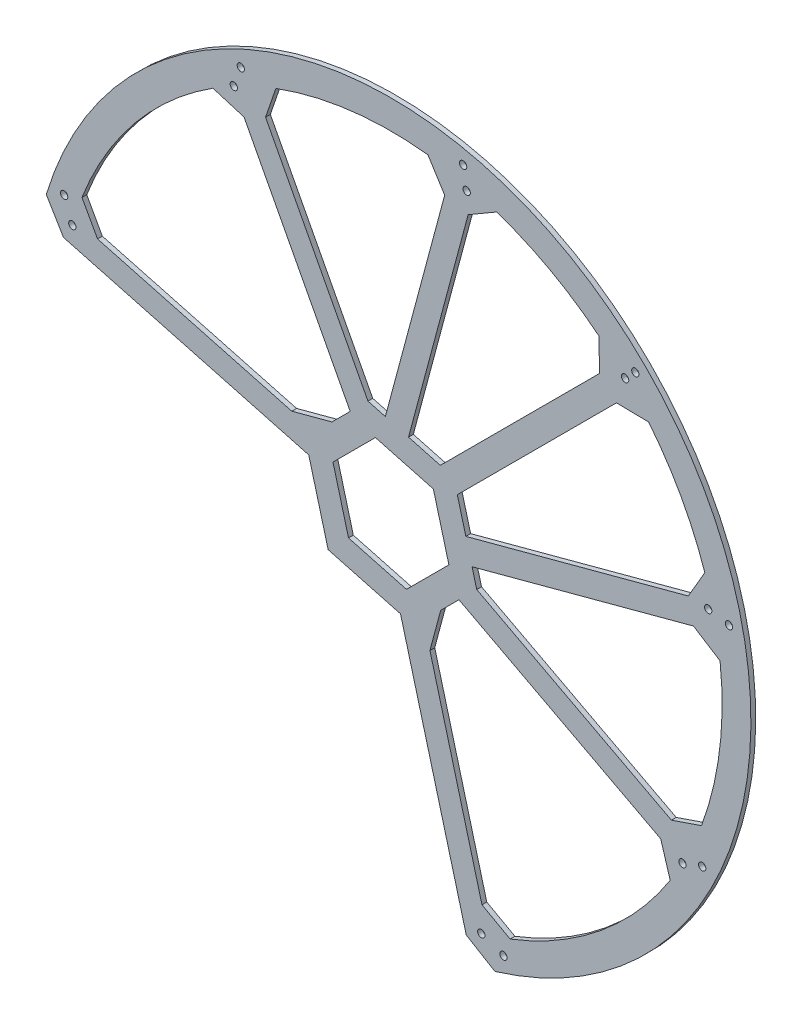
from build123d import *

# Parameters (mm, degrees)
EXTRUDE_11_DEPTH    = 2
CHAMFER_1_SIZE      = 10
CHAMFER_3_SIZE      = 10
SKETCH_4_R          = 1.52
CUT_EXTRUDE_1_DEPTH = 10


with BuildPart() as part:
    # 草图2 → 凸台-拉伸11 (new body)
    with BuildSketch(Plane.XY):
        with BuildLine():
            Line((116.986968716, -171.866279839), (116.986166566, -171.866494817))
            Line((116.986166566, -171.866494817), (146.957834859, -283.724244016))
            ThreePointArc((146.95783486, -283.724244021), (219.052953151, -31.555197901), (-33.116092969, -103.650316192))
            Line((-33.116092963, -103.650316193), (78.741656236, -133.621984487))
            Line((78.741656247, -133.621984484), (86.823548141, -163.784015655))
            Line((86.823548141, -163.784015655), (86.824011296, -163.784139757))
            Line((86.824011296, -163.784139757), (116.986968716, -171.866279839))
        make_face()
        Polygon((119.456975173, -161.769210408), (95.30929267, -155.298858383), (95.308829516, -155.298734281), (88.838353388, -131.150588624), (106.516022918, -113.472919094), (130.664168575, -119.943395221), (137.134644703, -144.091540879), align=None, mode=Mode.SUBTRACT)
        with BuildLine():
            Line((126.645296946, -169.277827092), (141.323054558, -154.60006948))
            Line((141.323054558, -154.60006948), (234.255998853, -203.48188474))
            ThreePointArc((234.255998853, -203.48188474), (200.365014055, -244.433677808), (153.509224986, -269.537128502))
            Line((153.509224986, -269.537128502), (126.645296946, -169.277827092))
        make_face(mode=Mode.SUBTRACT)
        with BuildLine():
            ThreePointArc((248.706632523, -112.641381763), (249.968706378, -154.348708565), (238.707168991, -194.526708951))
            Line((238.707168991, -194.526708951), (148.725754618, -147.19736942))
            Line((148.725754618, -147.19736942), (146.784206577, -139.951413486))
            Line((146.784206577, -139.951413486), (248.706632523, -112.641381763))
        make_face(mode=Mode.SUBTRACT)
        with BuildLine():
            ThreePointArc((-18.929686723, -97.098736021), (6.17383244, -50.2426152), (47.125895572, -16.351447355))
            Line((47.125895572, -16.351447355), (96.007676733, -109.284326822))
            Line((96.007676733, -109.284326822), (81.329397649, -123.962605906))
            Line((81.329397649, -123.962605906), (-18.929686723, -97.098736021))
        make_face(mode=Mode.SUBTRACT)
        with BuildLine():
            ThreePointArc((56.081079681, -11.900293037), (96.259335826, -0.638798731), (137.966891648, -1.901061882))
            Line((137.966891648, -1.901061882), (110.656845042, -103.823543372))
            Line((110.656845042, -103.823543372), (103.410518411, -101.881896003))
            Line((103.410518411, -101.881896003), (56.081079681, -11.900293037))
        make_face(mode=Mode.SUBTRACT)
        with BuildLine():
            ThreePointArc((147.738817906, -4.068769649), (179.372913634, -16.638491001), (206.967778767, -36.569304474))
            Line((206.967778767, -36.569304474), (133.573137745, -109.963945495))
            Line((133.573137745, -109.963945495), (120.316103305, -106.411733823))
            Line((120.316103305, -106.411733823), (147.738817906, -4.068769649))
        make_face(mode=Mode.SUBTRACT)
        with BuildLine():
            ThreePointArc((214.038825287, -43.640393577), (233.969445691, -71.235329731), (246.538975276, -102.869441968))
            Line((246.538975276, -102.869441968), (144.196016126, -130.292155223))
            Line((144.196016126, -130.292155223), (140.643866505, -117.03535236))
            Line((140.643866505, -117.03535236), (214.038825287, -43.640393577))
        make_face(mode=Mode.SUBTRACT)
    extrude(amount=-EXTRUDE_11_DEPTH)

    # 倒角1
    # the kernel refuses this chamfer: 10 mm, written as the material it adds along each edge
    with BuildSketch(Plane(origin=(246.538975276, -102.869441968, 0), x_dir=(-0.28555901452107074, 0.9583611267292487, 0), z_dir=(0, 0, -1))) as chamfer_1_piece_1:
        with BuildLine():
            Line((9.665018265, 0), (CHAMFER_1_SIZE * 0.0277867153721, -CHAMFER_1_SIZE * 0.999613874678))
            Line((CHAMFER_1_SIZE * 0.0277867153721, -CHAMFER_1_SIZE * 0.999613874678), (0, 0))
            ThreePointArc((0, 0), (4.969359021, 0.084571078), (9.665018265, 0))
        make_face()
    extrude(amount=2)
    with BuildSketch(Plane(origin=(214.038825287, -43.640393577, 0), x_dir=(-0.707106781186561, -0.707106781186534, 0), z_dir=(0, 0, -1))) as chamfer_1_piece_2:
        with BuildLine():
            Line((CHAMFER_1_SIZE, 0), (0.689672032, -9.65402706))
            ThreePointArc((0.689672032, -9.65402706), (0.269761539, -4.966357207), (0, 0))
            Line((0, 0), (CHAMFER_1_SIZE, 0))
        make_face()
    extrude(amount=2)
    with BuildSketch(Plane(origin=(238.707168991, -194.526708951, 0), x_dir=(0.38013608783902403, 0.9249305675143631, 0), z_dir=(0, 0, -1))) as chamfer_1_piece_3:
        with BuildLine():
            Line((9.685612303, 0), (CHAMFER_1_SIZE * 0.0941398773056, -CHAMFER_1_SIZE * 0.995558980423))
            Line((CHAMFER_1_SIZE * 0.0941398773056, -CHAMFER_1_SIZE * 0.995558980423), (0, 0))
            ThreePointArc((0, 0), (4.974727114, 0.084937068), (9.685612303, 0))
        make_face()
    extrude(amount=2)
    with BuildSketch(Plane(origin=(248.706632523, -112.641381763, 0), x_dir=(0.14636574749919642, -0.9892305433815727, 0), z_dir=(0, 0, -1))) as chamfer_1_piece_4:
        with BuildLine():
            Line((9.691773178, 0), (CHAMFER_1_SIZE * 0.114653249031, CHAMFER_1_SIZE * 0.99340557301))
            Line((CHAMFER_1_SIZE * 0.114653249031, CHAMFER_1_SIZE * 0.99340557301), (0, 0))
            ThreePointArc((0, 0), (4.976248684, -0.085046752), (9.691773178, 0))
        make_face()
    extrude(amount=2)
    with BuildSketch(Plane(origin=(206.967778767, -36.569304474, 0), x_dir=(-0.7556917941479319, 0.6549274099146253, 0), z_dir=(0, 0, -1))) as chamfer_1_piece_5:
        with BuildLine():
            Line((9.678628526, 0), (CHAMFER_1_SIZE * 0.0712511793936, -CHAMFER_1_SIZE * 0.997458404865))
            Line((CHAMFER_1_SIZE * 0.0712511793936, -CHAMFER_1_SIZE * 0.997458404865), (0, 0))
            ThreePointArc((0, 0), (4.972954578, 0.084812842), (9.678628526, 0))
        make_face()
    extrude(amount=2)
    with BuildSketch(Plane(origin=(147.738817906, -4.068769649, 0), x_dir=(0.9583596366559947, -0.28556401529007475, 0), z_dir=(0, 0, -1))) as chamfer_1_piece_6:
        with BuildLine():
            Line((9.665019928, 0), (CHAMFER_1_SIZE * 0.0277919314036, CHAMFER_1_SIZE * 0.999613729672))
            Line((CHAMFER_1_SIZE * 0.0277919314036, CHAMFER_1_SIZE * 0.999613729672), (0, 0))
            ThreePointArc((0, 0), (4.969359471, -0.084571108), (9.665019928, 0))
        make_face()
    extrude(amount=2)
    with BuildSketch(Plane(origin=(153.509224986, -269.537128502, 0), x_dir=(0.9450297338640432, 0.32698440652859245, 0), z_dir=(0, 0, -1))) as chamfer_1_piece_7:
        with BuildLine():
            Line((9.678629813, 0), (CHAMFER_1_SIZE * 0.071255359942, -CHAMFER_1_SIZE * 0.997458106228))
            Line((CHAMFER_1_SIZE * 0.071255359942, -CHAMFER_1_SIZE * 0.997458106228), (0, 0))
            ThreePointArc((0, 0), (4.972954909, 0.084812865), (9.678629813, 0))
        make_face()
    extrude(amount=2)
    with BuildSketch(Plane(origin=(234.255998853, -203.48188474, 0), x_dir=(-0.5077534832780394, -0.861502408713416, 0), z_dir=(0, 0, -1))) as chamfer_1_piece_8:
        with BuildLine():
            Line((9.671511766, 0), (CHAMFER_1_SIZE * 0.0483333592427, CHAMFER_1_SIZE * 0.998831260216))
            Line((CHAMFER_1_SIZE * 0.0483333592427, CHAMFER_1_SIZE * 0.998831260216), (0, 0))
            ThreePointArc((0, 0), (4.97109735, -0.08468637), (9.671511766, 0))
        make_face()
    extrude(amount=2)
    with BuildSketch(Plane(origin=(-18.929686723, -97.098736021, 0), x_dir=(0.32698155779507593, 0.9450307195334474, 0), z_dir=(0, 0, -1))) as chamfer_1_piece_9:
        with BuildLine():
            Line((9.678628888, 0), (CHAMFER_1_SIZE * 0.0712523531674, CHAMFER_1_SIZE * 0.997458321018))
            Line((CHAMFER_1_SIZE * 0.0712523531674, CHAMFER_1_SIZE * 0.997458321018), (0, 0))
            ThreePointArc((0, 0), (4.972954671, -0.084812848), (9.678628888, 0))
        make_face()
    extrude(amount=2)
    with BuildSketch(Plane(origin=(47.125895572, -16.351447355, 0), x_dir=(-0.8615033162863328, -0.5077519434011564, 0), z_dir=(0, 0, -1))) as chamfer_1_piece_10:
        with BuildLine():
            Line((9.671511206, 0), (CHAMFER_1_SIZE * 0.0483315739005, -CHAMFER_1_SIZE * 0.998831346607))
            Line((CHAMFER_1_SIZE * 0.0483315739005, -CHAMFER_1_SIZE * 0.998831346607), (0, 0))
            ThreePointArc((0, 0), (4.971097202, 0.08468636), (9.671511206, 0))
        make_face()
    extrude(amount=2)
    with BuildSketch(Plane(origin=(56.081079681, -11.900293037, 0), x_dir=(0.46552074617297745, -0.8850369680880875, 0), z_dir=(0, 0, -1))) as chamfer_1_piece_11:
        with BuildLine():
            Line((CHAMFER_1_SIZE, 0), (0.911819668, -9.642597213))
            ThreePointArc((0.911819668, -9.642597213), (0.383769224, -4.960629667), (0, 0))
            Line((0, 0), (CHAMFER_1_SIZE, 0))
        make_face()
    extrude(amount=2)
    with BuildSketch(Plane(origin=(137.966891648, -1.901061882, 0), x_dir=(-0.258819045102493, -0.9659258262890758, 0), z_dir=(0, 0, -1))) as chamfer_1_piece_12:
        with BuildLine():
            Line((CHAMFER_1_SIZE, 0), (1.111142712, 9.627865763))
            ThreePointArc((1.111142712, 9.627865763), (0.486031221, 4.953186227), (0, 0))
            Line((0, 0), (CHAMFER_1_SIZE, 0))
        make_face()
    extrude(amount=2)
    # the kernel refuses this chamfer: 10 mm, written as the material it takes off along each edge
    with BuildSketch(Plane(origin=(146.95783486, -283.724244018, 25.728190053), x_dir=(0.9662009253756813, 0.25779017010579985, 0), z_dir=(0, 0, -1))) as chamfer_1_2_piece_1:
        with BuildLine():
            Line((9.681979791, 0), (-CHAMFER_1_SIZE * 0.00106063647762, -CHAMFER_1_SIZE * 0.999999437516))
            Line((-CHAMFER_1_SIZE * 0.00106063647762, -CHAMFER_1_SIZE * 0.999999437516), (0, 0))
            ThreePointArc((0, 0), (4.980125863, 0.078072968), (9.681979791, 0))
        make_face()
    extrude(amount=53.456380107, mode=Mode.SUBTRACT)
    with BuildSketch(Plane(origin=(-33.116092966, -103.650316193, 25.728190053), x_dir=(0.25779017010579297, 0.966200925375683, 0), z_dir=(0, 0, -1))) as chamfer_1_2_piece_2:
        with BuildLine():
            Line((9.681979791, 0), (-CHAMFER_1_SIZE * 0.00106063647762, CHAMFER_1_SIZE * 0.999999437516))
            Line((-CHAMFER_1_SIZE * 0.00106063647762, CHAMFER_1_SIZE * 0.999999437516), (0, 0))
            ThreePointArc((0, 0), (4.980125863, -0.078072968), (9.681979791, 0))
        make_face()
    extrude(amount=53.456380107, mode=Mode.SUBTRACT)

    # 倒角3
    chamfer_3_edges = [part.edges().sort_by_distance(p)[0] for p in [
        (126.645296946, -169.277827092, -1),
        (81.329397649, -123.962605906, -1),
    ]]
    chamfer(chamfer_3_edges, length=CHAMFER_3_SIZE)

    # 草图4 → 切除-拉伸1 (cut)
    with BuildSketch(Plane(origin=(0, 0, -2), x_dir=(-1, 0, 0), z_dir=(0, 0, -1))):
        with Locations((-245.186502849, -106.060815296)):
            Circle(SKETCH_4_R)
        with Locations((-253.809433195, -107.539796629)):
            Circle(SKETCH_4_R)
        with Locations((-234.46368438, -203.099121031)):
            Circle(SKETCH_4_R)
        with Locations((-242.688279646, -200.179263146)):
            Circle(SKETCH_4_R)
        with Locations((-150.64247259, -270.384667581)):
            Circle(SKETCH_4_R)
        with Locations((-159.843873975, -273.784707323)):
            Circle(SKETCH_4_R)
        with Locations((-210.567284016, -40.040867037)):
            Circle(SKETCH_4_R)
        with Locations((-214.809924703, -35.79822635)):
            Circle(SKETCH_4_R)
        with Locations((-144.547335756, -5.421648203)):
            Circle(SKETCH_4_R)
        with Locations((-143.068354423, 3.201282143)):
            Circle(SKETCH_4_R)
        with Locations((-47.509030022, -16.144466672)):
            Circle(SKETCH_4_R)
        with Locations((-50.428887906, -7.919871406)):
            Circle(SKETCH_4_R)
        with Locations((19.776516528, -99.965678463)):
            Circle(SKETCH_4_R)
        with Locations(Location((23.176556271, -90.764277077, 0), (0, 0, 180))):
            Circle(SKETCH_4_R)
    extrude(amount=-CUT_EXTRUDE_1_DEPTH, mode=Mode.SUBTRACT)


solid = part.part
